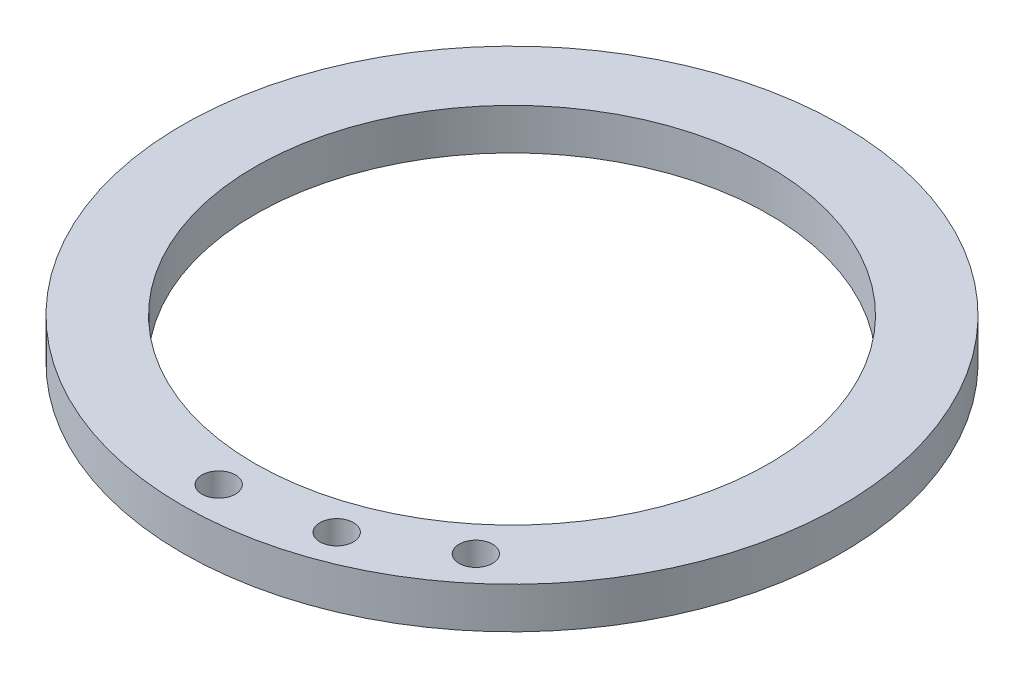
from build123d import *

# Parameters (mm, degrees)
SKETCH1_R            = 50.8
SKETCH1_R_2          = 39.624
RING_EXTRUSION_DEPTH = 6.35
SKETCH2_R            = 2.5796875
CONDUIT_HOLE_DEPTH   = 73.122135992
CIRPATTERN1_COUNT    = 3
CIRPATTERN1_ANGLE    = 40


with BuildPart() as part:
    # Sketch1 → Ring Extrusion (new body)
    with BuildSketch(Plane(origin=(0, 0, 0), x_dir=(1, 0, 0), z_dir=(0, 1, 0))):
        Circle(SKETCH1_R)
        Circle(SKETCH1_R_2, mode=Mode.SUBTRACT)
    extrude(amount=RING_EXTRUSION_DEPTH)

    # Sketch2 → Conduit Hole (cut, through all)
    with BuildSketch(Plane(origin=(0, 0, 0), x_dir=(1, 0, 0), z_dir=(0, 1, 0))):
        with Locations((0, -45.212)):
            Circle(SKETCH2_R)
    conduit_hole = extrude(amount=CONDUIT_HOLE_DEPTH, mode=Mode.SUBTRACT)

    # CirPattern1: Conduit Hole ×3 about axis
    cirpattern1_axis = Axis((0, 6.35, 0), (0, 1, 0))
    for i in range(1, CIRPATTERN1_COUNT):
        add(conduit_hole.rotate(cirpattern1_axis, i * CIRPATTERN1_ANGLE / (CIRPATTERN1_COUNT - 1)), mode=Mode.SUBTRACT)


solid = part.part
